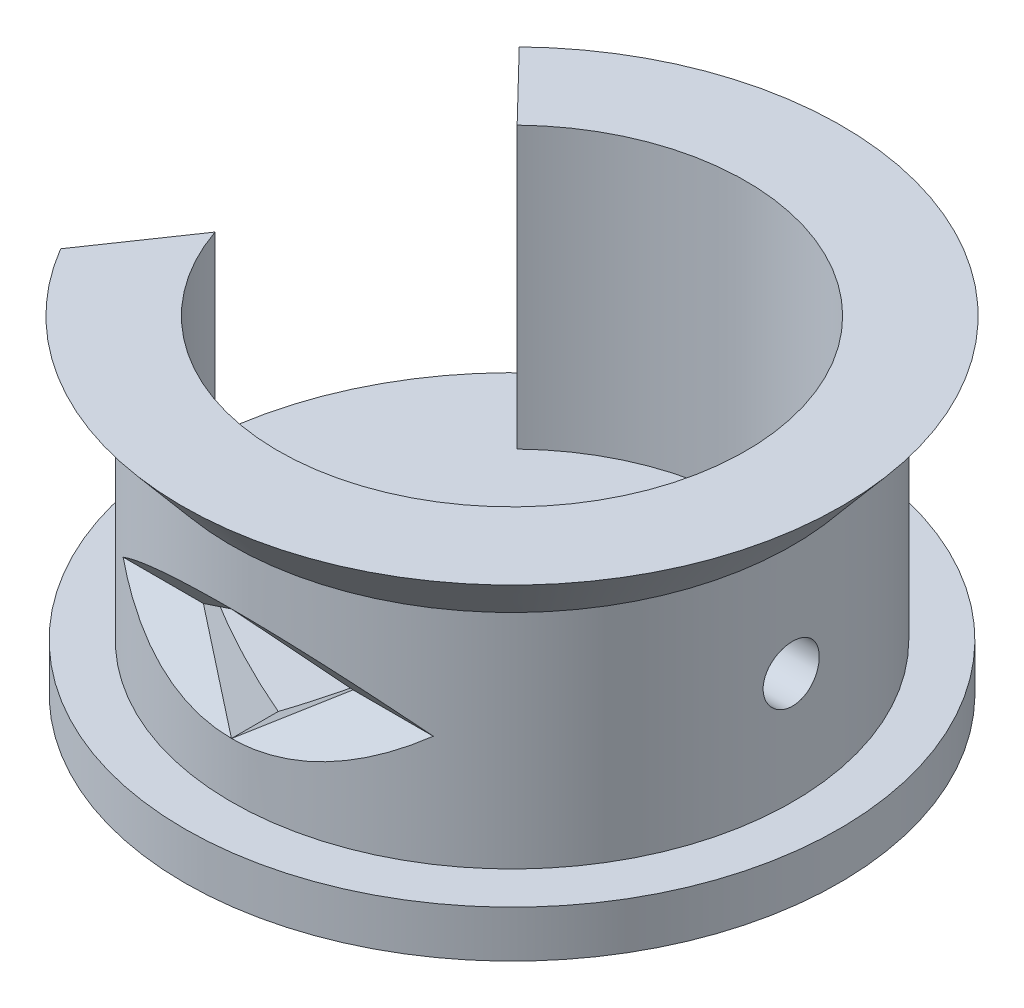
from build123d import *

# Parameters (mm, degrees)
SKETCH4_R                = 7
BOSS_EXTRUDE3_DEPTH      = 1
SKETCH5_R                = 6
SKETCH5_R_2              = 5
BOSS_EXTRUDE4_DEPTH      = 4.75
SKETCH6_W                = 6
SKETCH6_H                = 1.25
CUT_EXTRUDE3_START       = -3
SKETCH9_R                = 5
CUT_EXTRUDE3_DEPTH       = 3
CUT_EXTRUDE7_DEPTH       = 10
SKETCH13_R               = 2.4
CUT_EXTRUDE8_DEPTH       = 10
CUT_EXTRUDE9_START       = -6
CUT_EXTRUDE9_DEPTH       = 6
SKETCH15_R               = 0.6
CUT_EXTRUDE10_DEPTH      = 10
CUT_EXTRUDE14_DEPTH      = 10
CUT_EXTRUDE14_DEPTH_BACK = 10


with BuildPart() as part:
    # Sketch4 → Boss-Extrude3 (new body)
    with BuildSketch(Plane(origin=(0, 0, 0), x_dir=(1, 0, 0), z_dir=(0, 1, 0))):
        Circle(SKETCH4_R)
    extrude(amount=BOSS_EXTRUDE3_DEPTH)

    # Sketch5 → Boss-Extrude4 (add)
    with BuildSketch(Plane(origin=(0, 1, 0), x_dir=(1, 0, 0), z_dir=(0, 1, 0))):
        Circle(SKETCH5_R)
        Circle(SKETCH5_R_2, mode=Mode.SUBTRACT)
    extrude(amount=BOSS_EXTRUDE4_DEPTH)

    # Sketch6 → Revolve4 (revolve)
    with BuildSketch(Plane.XY):
        with Locations((3, 6.375)):
            Rectangle(SKETCH6_W, SKETCH6_H)
    revolve(axis=Axis((0, 5.75, 0), (0, 1, 0)))

    # Sketch9 → Cut-Extrude3 (cut)
    with BuildSketch(Plane(origin=(0, 7, 0), x_dir=(1, 0, 0), z_dir=(0, 1, 0)).offset(CUT_EXTRUDE3_START)):
        Circle(SKETCH9_R)
    extrude(amount=CUT_EXTRUDE3_DEPTH, mode=Mode.SUBTRACT)

    # Sketch11 → Cut-Extrude7 (cut)
    with BuildSketch(Plane.XY):
        Polygon((0, 4.575), (-1.6, 3.375), (0, 2.175), (1.6, 3.375), align=None)
    extrude(amount=CUT_EXTRUDE7_DEPTH, mode=Mode.SUBTRACT)

    # Sketch12 → Revolve8 (revolve)
    with BuildSketch(Plane(origin=(0, 0, 0), x_dir=(0, 0, -1), z_dir=(1, 0, 0))):
        Polygon((-6, 5.75), (-6, 7), (-7.048874539, 7), align=None)
    revolve(axis=Axis((0, 7, 0), (0, 1, 0)))

    # Sketch13 → Cut-Extrude8 (cut)
    with BuildSketch(Plane(origin=(0, 1, 0), x_dir=(1, 0, 0), z_dir=(0, 1, 0))):
        Circle(SKETCH13_R)
    extrude(amount=-CUT_EXTRUDE8_DEPTH, mode=Mode.SUBTRACT)

    # Sketch14 → Cut-Extrude9 (cut)
    with BuildSketch(Plane(origin=(0, 7, 0), x_dir=(1, 0, 0), z_dir=(0, 1, 0)).offset(CUT_EXTRUDE9_START)):
        with BuildLine():
            Line((-6.070978941, -3.581877575), (-4.730045335, -1.620700813))
            ThreePointArc((-4.730045335, -1.620700813), (-4.862114505, 1.166122867), (-3.480349058, 3.589870532))
            Line((-3.480349058, 3.589870532), (-4.906508772, 5.060909398))
            ThreePointArc((-4.906508772, 5.060909398), (-6.985753416, 0.941212769), (-6.070978941, -3.581877575))
        make_face()
    extrude(amount=CUT_EXTRUDE9_DEPTH, mode=Mode.SUBTRACT)

    # Sketch15 → Cut-Extrude10 (cut)
    with BuildSketch(Plane(origin=(0, 0, 0), x_dir=(0, 0, -1), z_dir=(1, 0, 0))):
        with Locations((0, 3.375)):
            Circle(SKETCH15_R)
    extrude(amount=CUT_EXTRUDE10_DEPTH, mode=Mode.SUBTRACT)

    # Sketch16 → Cut-Extrude14 (cut, two sides: drawn at the far end of the back side and taken through both)
    with BuildSketch(Plane(origin=(0, 0, 0), x_dir=(0, 0, -1), z_dir=(1, 0, 0)).offset(-CUT_EXTRUDE14_DEPTH_BACK)):
        Polygon((-5, 3.375), (-6, 4.575), (-6, 2.175), align=None)
    extrude(amount=CUT_EXTRUDE14_DEPTH + CUT_EXTRUDE14_DEPTH_BACK, mode=Mode.SUBTRACT)


solid = part.part
